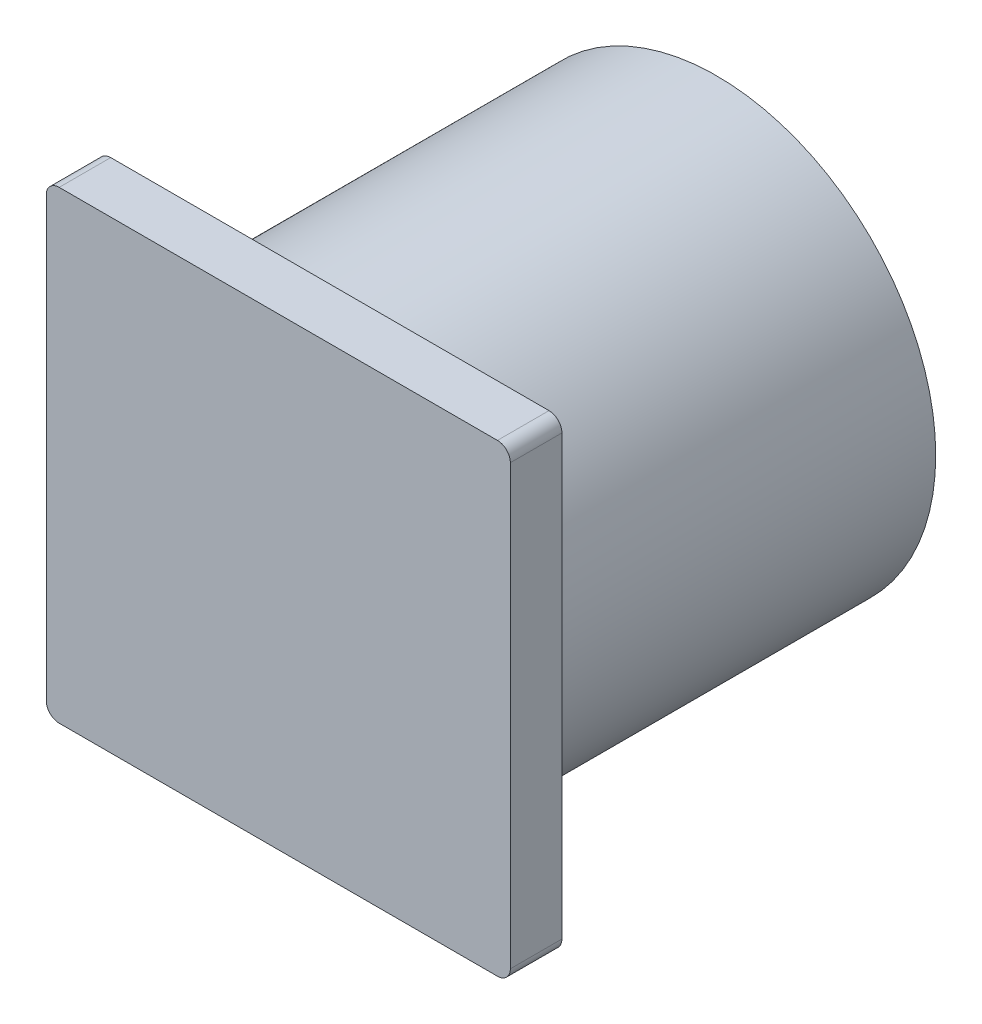
from build123d import *

# Parameters (mm, degrees)
ESQUISSE1_R        = 85
BOSS_EXTRU_1_DEPTH = 150
ESQUISSE2_W        = 180
ESQUISSE2_H        = 180
BOSS_EXTRU_2_DEPTH = 20
CONG_1_R           = 5
CONG_2_R           = 5
CONG_3_R           = 5
CONG_4_R           = 5
CONG_5_R           = 5


with BuildPart() as part:
    # Esquisse1 → Boss.-Extru.1 (new body)
    with BuildSketch(Plane.XY):
        Circle(ESQUISSE1_R)
    extrude(amount=BOSS_EXTRU_1_DEPTH)

    # Esquisse2 → Boss.-Extru.2 (add)
    with BuildSketch(Plane.XY.offset(150)):
        Rectangle(ESQUISSE2_W, ESQUISSE2_H)
    extrude(amount=BOSS_EXTRU_2_DEPTH)

    # Congé1
    cong_1_edges = [part.edges().sort_by_distance(p)[0] for p in [
        (-85, 0, 150),
    ]]
    fillet(cong_1_edges, radius=CONG_1_R - 0.0001)  # a hair under: the kernel refuses the full size

    # Congé2
    cong_2_edges = [part.edges().sort_by_distance(p)[0] for p in [
        (-90, 90, 160),
    ]]
    fillet(cong_2_edges, radius=CONG_2_R)

    # Congé3
    cong_3_edges = [part.edges().sort_by_distance(p)[0] for p in [
        (-90, -90, 160),
    ]]
    fillet(cong_3_edges, radius=CONG_3_R)

    # Congé4
    cong_4_edges = [part.edges().sort_by_distance(p)[0] for p in [
        (90, 90, 160),
    ]]
    fillet(cong_4_edges, radius=CONG_4_R)

    # Congé5
    cong_5_edges = [part.edges().sort_by_distance(p)[0] for p in [
        (90, -90, 160),
    ]]
    fillet(cong_5_edges, radius=CONG_5_R)


solid = part.part
